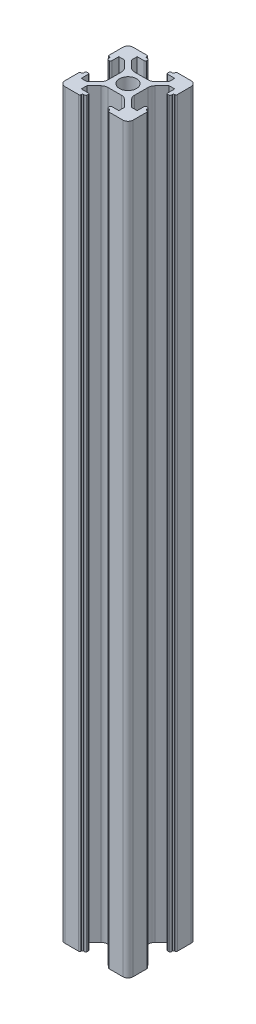
from build123d import *

# Parameters (mm, degrees)
BOSS_EXTRUDE1_DEPTH = 217.56
FILLET1_R           = 0.35


with BuildPart() as part:
    # Sketch1 → Boss-Extrude1 (new body)
    with BuildSketch(Plane(origin=(0, 0, 0), x_dir=(1, 0, 0), z_dir=(0, 1, 0))):
        with BuildLine():
            Line((5.5, 6.560660172), (3.425126266, 4.485786438))
            ThreePointArc((3.425126266, 4.485786438), (2.776279568, 4.052240935), (2.010912703, 3.9))
            Line((2.010912703, 3.9), (0, 3.9))
            Line((0, 3.899999921), (-2.010912625, 3.899999921))
            ThreePointArc((-2.010912625, 3.899999921), (-2.77627949, 4.052240856), (-3.425126187, 4.485786359))
            Line((-3.425126187, 4.485786359), (-5.5, 6.560660172))
            Line((-5.5, 6.560660172), (-5.5, 8.2))
            Line((-5.5, 8.2), (-3.1, 8.2))
            Line((-3.1, 8.2), (-3.1, 9.24))
            Line((-3.1, 9.24), (-4.1, 9.24))
            Line((-4.1, 9.24), (-4.1, 10))
            Line((-4.1, 10), (-8.5, 10))
            ThreePointArc((-8.5, 10), (-9.560660172, 9.560660172), (-10, 8.5))
            Line((-10, 8.5), (-10, 4.1))
            Line((-10, 4.1), (-9.24, 4.1))
            Line((-9.24, 4.1), (-9.24, 3.1))
            Line((-9.24, 3.1), (-8.2, 3.1))
            Line((-8.2, 3.1), (-8.2, 5.5))
            Line((-8.2, 5.5), (-6.560660172, 5.5))
            Line((-6.560660172, 5.5), (-4.485786438, 3.425126266))
            ThreePointArc((-4.485786438, 3.425126266), (-4.052240935, 2.776279568), (-3.9, 2.010912703))
            Line((-3.9, 2.010912703), (-3.9, 0))
            Line((-3.899999921, 0), (-3.899999921, -2.010912625))
            ThreePointArc((-3.899999921, -2.010912625), (-4.052240856, -2.77627949), (-4.485786359, -3.425126187))
            Line((-4.485786359, -3.425126187), (-6.560660172, -5.5))
            Line((-6.560660172, -5.5), (-8.2, -5.5))
            Line((-8.2, -5.5), (-8.2, -3.1))
            Line((-8.2, -3.1), (-9.24, -3.1))
            Line((-9.24, -3.1), (-9.24, -4.1))
            Line((-9.24, -4.1), (-10, -4.1))
            Line((-10, -4.1), (-10, -8.5))
            ThreePointArc((-10, -8.5), (-9.560660172, -9.560660172), (-8.5, -10))
            Line((-8.5, -10), (-4.1, -10))
            Line((-4.1, -10), (-4.1, -9.24))
            Line((-4.1, -9.24), (-3.1, -9.24))
            Line((-3.1, -9.24), (-3.1, -8.2))
            Line((-3.1, -8.2), (-5.5, -8.2))
            Line((-5.5, -8.2), (-5.5, -6.560660172))
            Line((-5.5, -6.560660172), (-3.425126266, -4.485786438))
            ThreePointArc((-3.425126266, -4.485786438), (-2.776279568, -4.052240935), (-2.010912703, -3.9))
            Line((-2.010912703, -3.9), (0, -3.9))
            Line((0, -3.899999921), (2.010912625, -3.899999921))
            ThreePointArc((2.010912625, -3.899999921), (2.77627949, -4.052240856), (3.425126187, -4.485786359))
            Line((3.425126187, -4.485786359), (5.5, -6.560660172))
            Line((5.5, -6.560660172), (5.5, -8.2))
            Line((5.5, -8.2), (3.1, -8.2))
            Line((3.1, -8.2), (3.1, -9.24))
            Line((3.1, -9.24), (4.1, -9.24))
            Line((4.1, -9.24), (4.1, -10))
            Line((4.1, -10), (8.5, -10))
            ThreePointArc((8.5, -10), (9.560660172, -9.560660172), (10, -8.5))
            Line((10, -8.5), (10, -4.1))
            Line((10, -4.1), (9.24, -4.1))
            Line((9.24, -4.1), (9.24, -3.1))
            Line((9.24, -3.1), (8.2, -3.1))
            Line((8.2, -3.1), (8.2, -5.5))
            Line((8.2, -5.5), (6.560660172, -5.5))
            Line((6.560660172, -5.5), (4.485786438, -3.425126266))
            ThreePointArc((4.485786438, -3.425126266), (4.052240935, -2.776279568), (3.9, -2.010912703))
            Line((3.9, -2.010912703), (3.9, 0))
            Line((3.899999921, 0), (3.899999921, 2.010912625))
            ThreePointArc((3.899999921, 2.010912625), (4.052240856, 2.77627949), (4.485786359, 3.425126187))
            Line((4.485786359, 3.425126187), (6.560660172, 5.5))
            Line((6.560660172, 5.5), (8.2, 5.5))
            Line((8.2, 5.5), (8.2, 3.1))
            Line((8.2, 3.1), (9.24, 3.1))
            Line((9.24, 3.1), (9.24, 4.1))
            Line((9.24, 4.1), (10, 4.1))
            Line((10, 4.1), (10, 8.5))
            ThreePointArc((10, 8.5), (9.560660172, 9.560660172), (8.5, 10))
            Line((8.5, 10), (4.1, 10))
            Line((4.1, 10), (4.1, 9.24))
            Line((4.1, 9.24), (3.1, 9.24))
            Line((3.1, 9.24), (3.1, 8.2))
            Line((3.1, 8.2), (5.5, 8.2))
            Line((5.5, 8.2), (5.5, 6.560660172))
        make_face()
        with BuildLine():
            ThreePointArc((0, 2.5), (1.767766953, 1.767766953), (2.5, 0))
            ThreePointArc((2.5, 0), (1.767766953, -1.767766953), (0, -2.5))
            ThreePointArc((0, -2.5), (-1.767766953, -1.767766953), (-2.5, 0))
            ThreePointArc((-2.5, 0), (-1.767766953, 1.767766953), (0, 2.5))
        make_face(mode=Mode.SUBTRACT)
    extrude(amount=BOSS_EXTRUDE1_DEPTH)

    # Fillet1
    fillet1_edges = [part.edges().sort_by_distance(p)[0] for p in [
        (-4.1, 108.78, -10),
        (-4.1, 108.78, -9.24),
        (-3.1, 108.78, -9.24),
        (-3.1, 108.78, -8.2),
        (-9.24, 108.78, -4.1),
        (-10, 108.78, -4.1),
        (-9.24, 108.78, -3.1),
        (-8.2, 108.78, -3.1),
        (-10, 108.78, 4.1),
        (-9.24, 108.78, 4.1),
        (-9.24, 108.78, 3.1),
        (-8.2, 108.78, 3.1),
        (-4.1, 108.78, 10),
        (-4.1, 108.78, 9.24),
        (-3.1, 108.78, 9.24),
        (-3.1, 108.78, 8.2),
        (4.1, 108.78, 10),
        (4.1, 108.78, 9.24),
        (3.1, 108.78, 9.24),
        (3.1, 108.78, 8.2),
        (10, 108.78, 4.1),
        (9.24, 108.78, 4.1),
        (9.24, 108.78, 3.1),
        (8.2, 108.78, 3.1),
        (10, 108.78, -4.1),
        (9.24, 108.78, -4.1),
        (9.24, 108.78, -3.1),
        (8.2, 108.78, -3.1),
        (3.1, 108.78, -8.2),
        (4.1, 108.78, -10),
        (5.5, 108.78, -6.560660172),
        (3.1, 108.78, -9.24),
        (4.1, 108.78, -9.24),
    ]]
    fillet(fillet1_edges, radius=FILLET1_R)


solid = part.part
